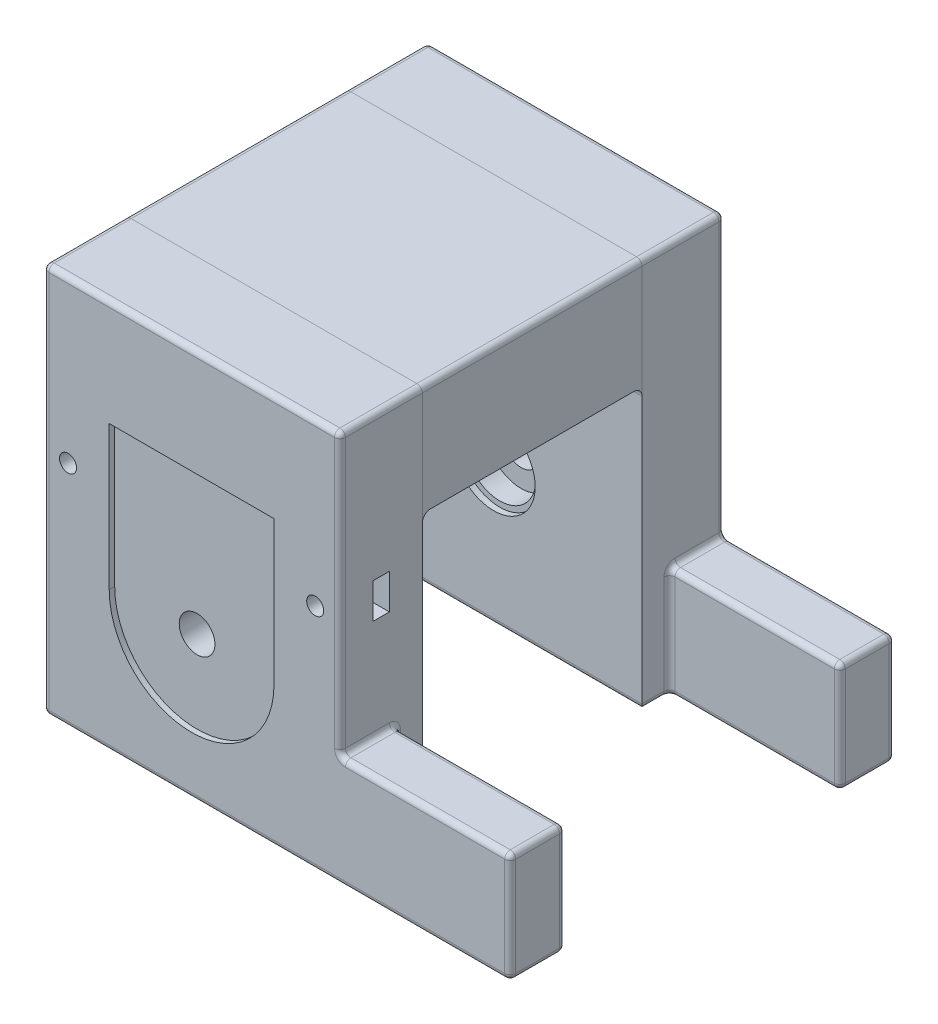
from build123d import *

# Parameters (mm, degrees)
BOSS_EXTRU_1_DEPTH           = 10
ESQUISSE2_W                  = 54
ESQUISSE2_H                  = 71
BOSS_EXTRU_2_DEPTH           = 50
CONG_2_R                     = 1
ENL_V_MAT_EXTRU_1_DEPTH      = 116.69464119
ESQUISSE6_R                  = 7.55
ENL_V_MAT_EXTRU_3_DEPTH      = 1.1
ESQUISSE6_4_R                = 6.55
ENL_V_MAT_EXTRU_4_DEPTH      = 5
ESQUISSE6_5_R                = 3.25
ENL_V_MAT_EXTRU_5_DEPTH      = 85.860179118
ESQUISSE7_R                  = 3.25
ENL_V_MAT_EXTRU_6_DEPTH      = 1
ENL_V_MAT_EXTRU_7_REACH      = 97.269
ESQUISSE8_R                  = 1.55
ENL_V_START                  = -6
ESQUISSE10_R                 = 3.2
ENL_V_MAT_EXTRU_11_DEPTH     = 3
ESQUISSE9_W                  = 3
ESQUISSE9_H                  = 6.4
ENL_V_MAT_EXTRU_12_DEPTH     = 4.5
CONG_3_R                     = 1
FRACTIONNER1_SURFACE_1_BACK  = 132.019
FRACTIONNER1_SURFACE_1_DEPTH = 264.038
FRACTIONNER1_SURFACE_2_BACK  = 132.019
FRACTIONNER1_SURFACE_2_DEPTH = 264.038


with BuildPart() as part:
    # Esquisse1 → Boss.-Extru.1 (new body)
    with BuildSketch(Plane.XY):
        Polygon((0, 15.5), (0, -15.5), (31, -15.5), (31, -35.5), (-54, -35.5), (-54, 35.5), (0, 35.5), align=None)
    boss_extru_1 = extrude(amount=BOSS_EXTRU_1_DEPTH)

    # Esquisse2 → Boss.-Extru.2 (add)
    with BuildSketch(Plane.XY.offset(10)):
        with Locations((-27, 0)):
            Rectangle(ESQUISSE2_W, ESQUISSE2_H)
    extrude(amount=BOSS_EXTRU_2_DEPTH)

    # Symétrie2: Boss.-Extru.1 across plane
    add(boss_extru_1.mirror(Plane.XY.offset(35)))

    # Congé2
    cong_2_edges = [part.edges().sort_by_distance(p)[0] for p in [
        (15.5, -15.5, 0),
        (31, -15.5, 5),
        (31, -35.5, 5),
        (-54, -35.5, 35),
        (-54, 35.5, 35),
        (0, 35.5, 35),
        (0, -15.5, 5),
        (15.5, -35.5, 10),
        (0, -25.5, 10),
        (0, -35.5, 35),
        (0, -25.5, 60),
        (31, -25.5, 10),
        (15.5, -15.5, 60),
        (0, -15.5, 65),
        (31, -25.5, 60),
        (31, -15.5, 65),
        (15.5, -35.5, 60),
        (31, -35.5, 65),
        (15.5, -15.5, 70),
        (0, 10, 70),
        (-27, 35.5, 70),
        (-54, 0, 70),
        (-11.5, -35.5, 70),
        (31, -25.5, 70),
        (15.5, -15.5, 10),
        (31, -25.5, 0),
        (-11.5, -35.5, 0),
        (-54, 0, 0),
        (-27, 35.5, 0),
        (0, 10, 0),
    ]]
    fillet(cong_2_edges, radius=CONG_2_R)

    # Esquisse3 → Enlèv. mat.-Extru.1 (cut, through all)
    with BuildSketch(Plane.ZY.offset(54)):
        with BuildLine():
            Line((16.5, 15.5), (53.5, 15.5))
            ThreePointArc((53.5, 15.5), (54.560660172, 15.060660172), (55, 14))
            Line((55, 14), (55, -35.5))
            Line((55, -35.5), (15, -35.5))
            Line((15, -35.5), (15, 14))
            ThreePointArc((15, 14), (15.439339828, 15.060660172), (16.5, 15.5))
        make_face()
    extrude(amount=-ENL_V_MAT_EXTRU_1_DEPTH, mode=Mode.SUBTRACT)

    # Esquisse6 → Enlèv. mat.-Extru.3 (cut)
    with BuildSketch(Plane.XY.offset(15)):
        with Locations((-27, -10)):
            Circle(ESQUISSE6_R)
    enl_v_mat_extru_3 = extrude(amount=-ENL_V_MAT_EXTRU_3_DEPTH, mode=Mode.SUBTRACT)

    # Esquisse6<4> → Enlèv. mat.-Extru.4 (cut)
    with BuildSketch(Plane.XY.offset(15)):
        with Locations((-27, -10)):
            Circle(ESQUISSE6_4_R)
    enl_v_mat_extru_4 = extrude(amount=-ENL_V_MAT_EXTRU_4_DEPTH, mode=Mode.SUBTRACT)

    # Esquisse6<5> → Enlèv. mat.-Extru.5 (cut, through all)
    with BuildSketch(Plane.XY.offset(15)):
        with Locations((-27, -10)):
            Circle(ESQUISSE6_5_R)
    enl_v_mat_extru_5 = extrude(amount=-ENL_V_MAT_EXTRU_5_DEPTH, mode=Mode.SUBTRACT)

    # Symétrie3: Enlèv. mat.-Extru.3, Enlèv. mat.-Extru.4, Enlèv. mat.-Extru.5 across plane
    add(enl_v_mat_extru_3.mirror(Plane.XY.offset(35)), mode=Mode.SUBTRACT)
    add(enl_v_mat_extru_4.mirror(Plane.XY.offset(35)), mode=Mode.SUBTRACT)
    add(enl_v_mat_extru_5.mirror(Plane.XY.offset(35)), mode=Mode.SUBTRACT)

    # Esquisse7 → Enlèv. mat.-Extru.6 (cut)
    with BuildSketch(Plane.XY.offset(70)):
        with BuildLine():
            Line((-42, -10), (-42, 16.2))
            Line((-42, 16.2), (-12, 16.2))
            Line((-12, 16.2), (-12, -10))
            ThreePointArc((-12, -10), (-27, -25), (-42, -10))
        make_face()
        with Locations(Location((-27, -10, 0), (0, 0, 180))):
            Circle(ESQUISSE7_R, mode=Mode.SUBTRACT)
    extrude(amount=-ENL_V_MAT_EXTRU_6_DEPTH, mode=Mode.SUBTRACT)

    # Esquisse8 → Enlèv. mat.-Extru.7 (cut, up to next)
    with BuildSketch(Plane.XY.offset(70), mode=Mode.PRIVATE) as enl_v_mat_extru_7_sk1:
        with Locations((-4.5, 6.2)):
            Circle(ESQUISSE8_R)
    enl_v_mat_extru_7_tool1 = extrude(enl_v_mat_extru_7_sk1.sketch, amount=-ENL_V_MAT_EXTRU_7_REACH, mode=Mode.PRIVATE) & part.part
    # Esquisse8 → Enlèv. mat.-Extru.7 (cut, up to next)
    with BuildSketch(Plane.XY.offset(70), mode=Mode.PRIVATE) as enl_v_mat_extru_7_sk2:
        with Locations(Location((-49.5, 6.2, 0), (0, 0, 270))):
            Circle(ESQUISSE8_R)
    enl_v_mat_extru_7_tool2 = extrude(enl_v_mat_extru_7_sk2.sketch, amount=-ENL_V_MAT_EXTRU_7_REACH, mode=Mode.PRIVATE) & part.part
    add(enl_v_mat_extru_7_tool1.solids().sort_by_distance((-4.5, 6.2, 70))[0], mode=Mode.SUBTRACT)
    add(enl_v_mat_extru_7_tool2.solids().sort_by_distance((-49.5, 6.2, 70))[0], mode=Mode.SUBTRACT)

    # Esquisse10 → Enlèv. mat.-Extru.11 (cut)
    with BuildSketch(Plane.XY.offset(70).offset(ENL_V_START)):
        with Locations((-4.5, 6.2)):
            Circle(ESQUISSE10_R)
    enl_v_mat_extru_11 = extrude(amount=-ENL_V_MAT_EXTRU_11_DEPTH, mode=Mode.SUBTRACT)

    # Esquisse9 → Enlèv. mat.-Extru.12 (cut)
    with BuildSketch(Plane(origin=(0, 0, 0), x_dir=(0, 0, -1), z_dir=(1, 0, 0))):
        with Locations((-62.5, 6.2)):
            Rectangle(ESQUISSE9_W, ESQUISSE9_H)
    enl_v_mat_extru_12 = extrude(amount=-ENL_V_MAT_EXTRU_12_DEPTH, mode=Mode.SUBTRACT)

    # Symétrie4: Enlèv. mat.-Extru.11, Enlèv. mat.-Extru.12 across plane
    add(enl_v_mat_extru_11.mirror(Plane(origin=(-27, 0, 0), x_dir=(0, 0, 1), z_dir=(1, 0, 0))), mode=Mode.SUBTRACT)
    add(enl_v_mat_extru_12.mirror(Plane(origin=(-27, 0, 0), x_dir=(0, 0, 1), z_dir=(1, 0, 0))), mode=Mode.SUBTRACT)

    # Congé3
    # the kernel refuses this fillet: 1 mm, written as the material it takes off along each edge
    with BuildSketch(Plane(origin=(-55.5, -35.5, 55), x_dir=(0, 0, 1), z_dir=(1, 0, 0))) as cong_3_piece_1:
        with BuildLine():
            CenterArc((CONG_3_R, -CONG_3_R), CONG_3_R, 90, 90)
            Line((0, -CONG_3_R), (0, 0))
            Line((0, 0), (CONG_3_R, 0))
        make_face()
    extrude(amount=57, mode=Mode.SUBTRACT)
    with BuildSketch(Plane(origin=(-55.5, -35.5, 15), x_dir=(0, 0, -1), z_dir=(1, 0, 0))) as cong_3_piece_2:
        with BuildLine():
            CenterArc((CONG_3_R, CONG_3_R), CONG_3_R, 180, 90)
            Line((0, CONG_3_R), (0, 0))
            Line((0, 0), (CONG_3_R, 0))
        make_face()
    extrude(amount=57, mode=Mode.SUBTRACT)


with BuildPart() as body_2:
    # Fractionner1: the piece behind the surface
    add(part.part)
    # Fractionner1 surface: a surface, the sketch's curves swept straight by 264.038 mm
    with BuildLine(Plane.ZY.offset(54).offset(-FRACTIONNER1_SURFACE_1_BACK), mode=Mode.PRIVATE) as fractionner1_surface_1_path:
        Line((15, -34.5), (15, 35.5))
        Line((15, 35.5), (55, 35.5))
        Line((55, 35.5), (55, -34.5))
        Line((55, -34.5), (55, -35.5))
        Line((55, -35.5), (15, -35.5))
        Line((15, -35.5), (15, -34.5))
    fractionner1_surface_1 = Shell.extrude(fractionner1_surface_1_path.wire(), (-1 * FRACTIONNER1_SURFACE_1_DEPTH, 0 * FRACTIONNER1_SURFACE_1_DEPTH, 0 * FRACTIONNER1_SURFACE_1_DEPTH))
    split(bisect_by=fractionner1_surface_1, keep=Keep.BOTTOM)


with BuildPart() as part_1:
    add(part.part)

    # Fractionner1: split by a surface, the side it looks to stays
    # Fractionner1 surface: a surface, the sketch's curves swept straight by 264.038 mm
    with BuildLine(Plane.ZY.offset(54).offset(-FRACTIONNER1_SURFACE_2_BACK), mode=Mode.PRIVATE) as fractionner1_surface_2_path:
        Line((15, -34.5), (15, 35.5))
        Line((15, 35.5), (55, 35.5))
        Line((55, 35.5), (55, -34.5))
        Line((55, -34.5), (55, -35.5))
        Line((55, -35.5), (15, -35.5))
        Line((15, -35.5), (15, -34.5))
    fractionner1_surface_2 = Shell.extrude(fractionner1_surface_2_path.wire(), (-1 * FRACTIONNER1_SURFACE_2_DEPTH, 0 * FRACTIONNER1_SURFACE_2_DEPTH, 0 * FRACTIONNER1_SURFACE_2_DEPTH))
    split(bisect_by=fractionner1_surface_2, keep=Keep.TOP)


solid = Compound([body_2.part, part_1.part])
